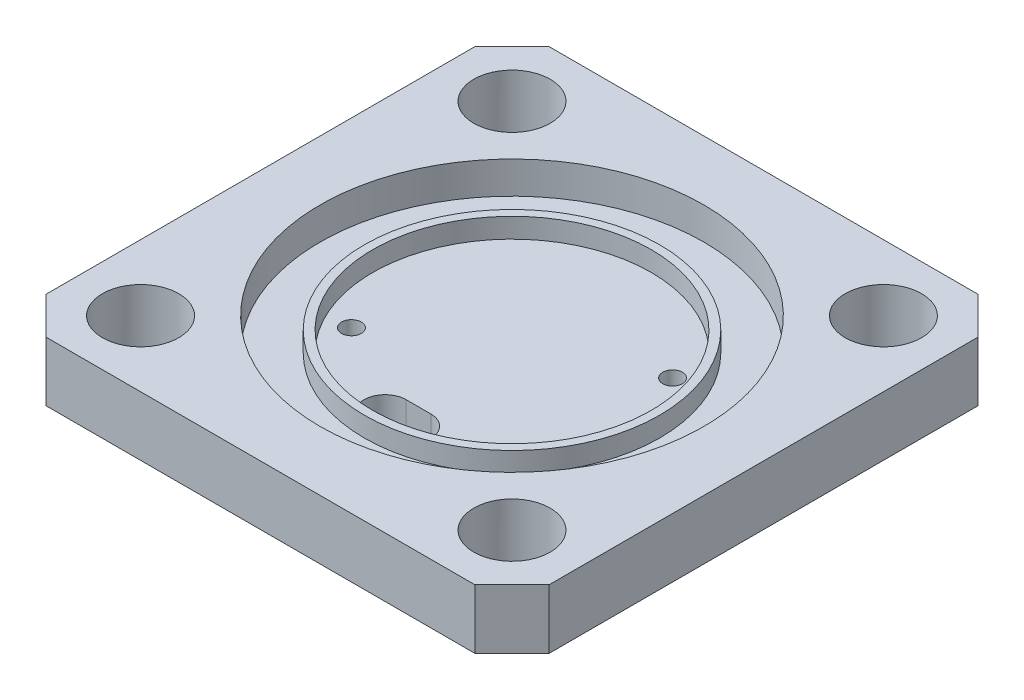
from build123d import *

# Parameters (mm, degrees)
SKETCH1_W           = 40.64
SKETCH1_H           = 40.64
BOSS_EXTRUDE1_DEPTH = 4.8
CUT_EXTRUDE1_REACH  = 31.135
SKETCH2_R           = 3.085
CHAMFER1_SIZE       = 3
SKETCH3_R           = 11.25
CUT_EXTRUDE2_DEPTH  = 2.6
SKETCH4_R           = 15.5
SKETCH4_R_2         = 11.925
CUT_EXTRUDE3_DEPTH  = 2.6
CUT_EXTRUDE4_DEPTH  = 29.854199001
SKETCH6_R           = 11.925
SKETCH6_R_2         = 11.25
CUT_EXTRUDE5_DEPTH  = 1
SKETCH7_R           = 0.8
CUT_EXTRUDE6_DEPTH  = 29.854199001


with BuildPart() as part:
    # Sketch1 → Boss-Extrude1 (new body)
    with BuildSketch(Plane(origin=(0, 0, 0), x_dir=(1, 0, 0), z_dir=(0, 1, 0))):
        Rectangle(SKETCH1_W, SKETCH1_H)
    extrude(amount=BOSS_EXTRUDE1_DEPTH)

    # Sketch2 → Cut-Extrude1 (cut, up to next)
    with BuildSketch(Plane(origin=(0, 4.8, 0), x_dir=(1, 0, 0), z_dir=(0, 1, 0)), mode=Mode.PRIVATE) as cut_extrude1_sk1:
        with Locations((-15, 15)):
            Circle(SKETCH2_R)
    cut_extrude1_tool1 = extrude(cut_extrude1_sk1.sketch, amount=-CUT_EXTRUDE1_REACH, mode=Mode.PRIVATE) & part.part
    # Sketch2 → Cut-Extrude1 (cut, up to next)
    with BuildSketch(Plane(origin=(0, 4.8, 0), x_dir=(1, 0, 0), z_dir=(0, 1, 0)), mode=Mode.PRIVATE) as cut_extrude1_sk2:
        with Locations((15, 15)):
            Circle(SKETCH2_R)
    cut_extrude1_tool2 = extrude(cut_extrude1_sk2.sketch, amount=-CUT_EXTRUDE1_REACH, mode=Mode.PRIVATE) & part.part
    # Sketch2 → Cut-Extrude1 (cut, up to next)
    with BuildSketch(Plane(origin=(0, 4.8, 0), x_dir=(1, 0, 0), z_dir=(0, 1, 0)), mode=Mode.PRIVATE) as cut_extrude1_sk3:
        with Locations((15, -15)):
            Circle(SKETCH2_R)
    cut_extrude1_tool3 = extrude(cut_extrude1_sk3.sketch, amount=-CUT_EXTRUDE1_REACH, mode=Mode.PRIVATE) & part.part
    # Sketch2 → Cut-Extrude1 (cut, up to next)
    with BuildSketch(Plane(origin=(0, 4.8, 0), x_dir=(1, 0, 0), z_dir=(0, 1, 0)), mode=Mode.PRIVATE) as cut_extrude1_sk4:
        with Locations((-15, -15)):
            Circle(SKETCH2_R)
    cut_extrude1_tool4 = extrude(cut_extrude1_sk4.sketch, amount=-CUT_EXTRUDE1_REACH, mode=Mode.PRIVATE) & part.part
    add(cut_extrude1_tool1.solids().sort_by_distance((-15, 4.8, -15))[0], mode=Mode.SUBTRACT)
    add(cut_extrude1_tool2.solids().sort_by_distance((15, 4.8, -15))[0], mode=Mode.SUBTRACT)
    add(cut_extrude1_tool3.solids().sort_by_distance((15, 4.8, 15))[0], mode=Mode.SUBTRACT)
    add(cut_extrude1_tool4.solids().sort_by_distance((-15, 4.8, 15))[0], mode=Mode.SUBTRACT)

    # Chamfer1
    chamfer1_edges = [part.edges().sort_by_distance(p)[0] for p in [
        (-20.32, 2.4, 20.32),
        (20.32, 2.4, 20.32),
        (20.32, 2.4, -20.32),
        (-20.32, 2.4, -20.32),
    ]]
    chamfer(chamfer1_edges, length=CHAMFER1_SIZE)

    # Sketch3 → Cut-Extrude2 (cut)
    with BuildSketch(Plane(origin=(0, 4.8, 0), x_dir=(1, 0, 0), z_dir=(0, 1, 0))):
        Circle(SKETCH3_R)
    extrude(amount=-CUT_EXTRUDE2_DEPTH, mode=Mode.SUBTRACT)

    # Sketch4 → Cut-Extrude3 (cut)
    with BuildSketch(Plane(origin=(0, 4.8, 0), x_dir=(1, 0, 0), z_dir=(0, 1, 0))):
        Circle(SKETCH4_R)
        Circle(SKETCH4_R_2, mode=Mode.SUBTRACT)
    extrude(amount=-CUT_EXTRUDE3_DEPTH, mode=Mode.SUBTRACT)

    # Sketch5 → Cut-Extrude4 (cut, through all)
    with BuildSketch(Plane(origin=(0, 2.2, 0), x_dir=(1, 0, 0), z_dir=(0, 1, 0))):
        with BuildLine():
            Line((-1, -7.55), (1, -7.55))
            ThreePointArc((1, -7.55), (2.7, -9.25), (1, -10.95))
            Line((1, -10.95), (-1, -10.95))
            ThreePointArc((-1, -10.95), (-2.7, -9.25), (-1, -7.55))
        make_face()
    extrude(amount=-CUT_EXTRUDE4_DEPTH, mode=Mode.SUBTRACT)

    # Sketch6 → Cut-Extrude5 (cut)
    with BuildSketch(Plane(origin=(0, 4.8, 0), x_dir=(1, 0, 0), z_dir=(0, 1, 0))):
        Circle(SKETCH6_R)
        Circle(SKETCH6_R_2, mode=Mode.SUBTRACT)
    extrude(amount=-CUT_EXTRUDE5_DEPTH, mode=Mode.SUBTRACT)

    # Sketch7 → Cut-Extrude6 (cut, through all)
    with BuildSketch(Plane(origin=(0, 2.2, 0), x_dir=(1, 0, 0), z_dir=(0, 1, 0))):
        with Locations((8.243053696, 4.727309167)):
            Circle(SKETCH7_R)
        with Locations((-8.243053696, -4.727309167)):
            Circle(SKETCH7_R)
    extrude(amount=-CUT_EXTRUDE6_DEPTH, mode=Mode.SUBTRACT)


solid = part.part
